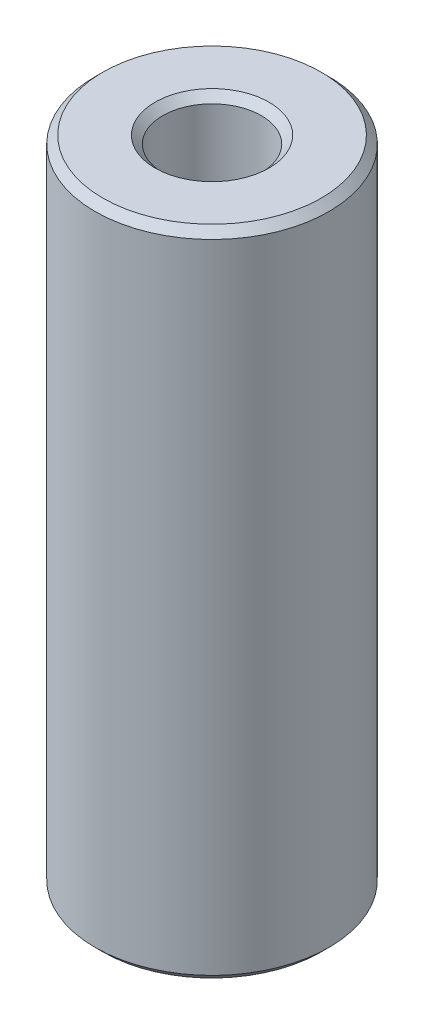
from build123d import *

# Parameters (mm, degrees)
SKETCH1_R           = 30
BOSS_EXTRUDE1_DEPTH = 167.517779389
SKETCH2_R           = 12.653350004
CUT_EXTRUDE1_DEPTH  = 173.806847119
CHAMFER1_SIZE       = 1.987234079


with BuildPart() as part:
    # Sketch1 → Boss-Extrude1 (new body)
    with BuildSketch(Plane(origin=(0, 0, 0), x_dir=(1, 0, 0), z_dir=(0, 1, 0))):
        Circle(SKETCH1_R)
    extrude(amount=BOSS_EXTRUDE1_DEPTH)

    # Sketch2 → Cut-Extrude1 (cut, through all)
    with BuildSketch(Plane(origin=(0, 0, 0), x_dir=(1, 0, 0), z_dir=(0, 1, 0))):
        Circle(SKETCH2_R)
    extrude(amount=CUT_EXTRUDE1_DEPTH, mode=Mode.SUBTRACT)

    # Chamfer1
    chamfer1_edges = [part.edges().sort_by_distance(p)[0] for p in [
        (-12.653350004, 167.517779389, 0),
        (-12.653350004, 0, 0),
        (-30, 0, 0),
        (-30, 167.517779389, 0),
    ]]
    chamfer(chamfer1_edges, length=CHAMFER1_SIZE)


solid = part.part
